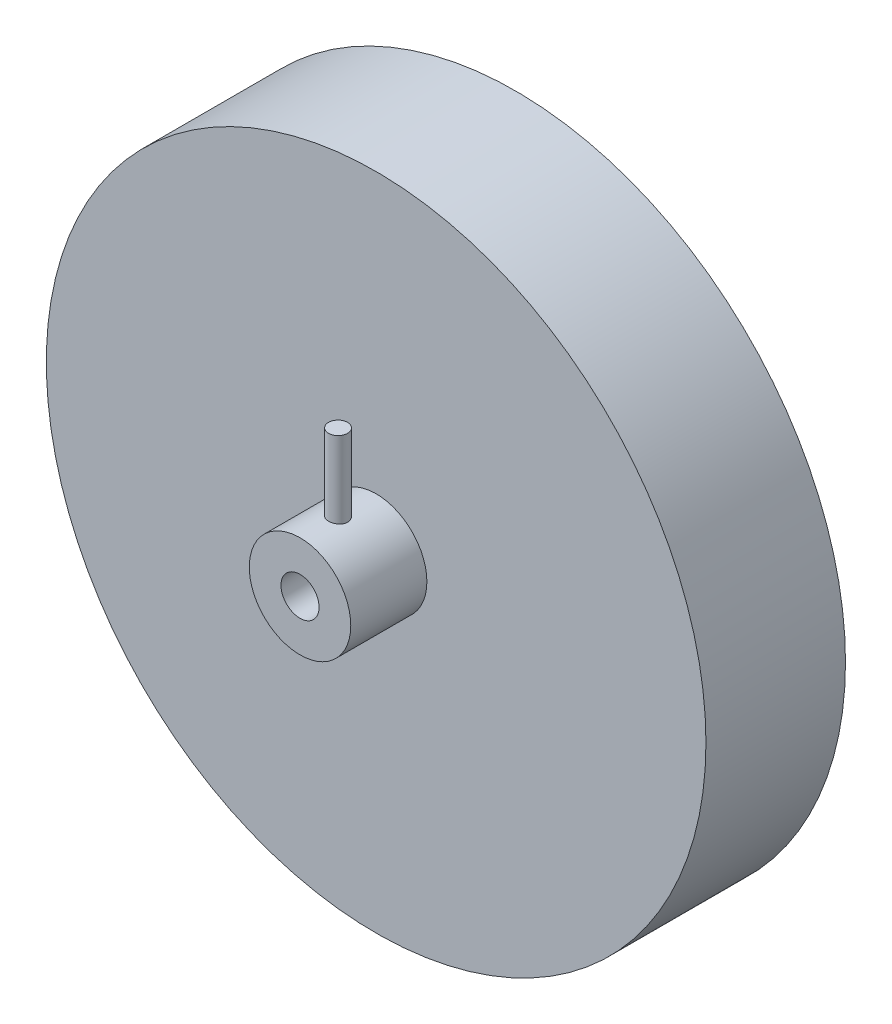
from build123d import *

# Parameters (mm, degrees)
SKETCH1_R           = 52
BOSS_EXTRUDE1_DEPTH = 11
SKETCH2_R           = 8
BOSS_EXTRUDE2_DEPTH = 12
SKETCH3_R           = 1.5
BOSS_EXTRUDE3_DEPTH = 20
SKETCH4_R           = 3
CUT_EXTRUDE3_DEPTH  = 12


with BuildPart() as part:
    # Sketch1 → Boss-Extrude1 (new, symmetric)
    with BuildSketch(Plane.XY):
        Circle(SKETCH1_R)
    extrude(amount=BOSS_EXTRUDE1_DEPTH, both=True)

    # Sketch2 → Boss-Extrude2 (add)
    with BuildSketch(Plane.XY.offset(11)):
        Circle(SKETCH2_R)
    extrude(amount=BOSS_EXTRUDE2_DEPTH)

    # Sketch3 → Boss-Extrude3 (add)
    with BuildSketch(Plane(origin=(0, 0, 0), x_dir=(1, 0, 0), z_dir=(0, 1, 0))):
        with Locations((0, -17)):
            Circle(SKETCH3_R)
    extrude(amount=BOSS_EXTRUDE3_DEPTH)

    # Sketch4 → Cut-Extrude3 (cut)
    with BuildSketch(Plane(origin=(0, 0, 23), x_dir=(-1, 0, 0), z_dir=(0, 0, -1))):
        Circle(SKETCH4_R)
    extrude(amount=CUT_EXTRUDE3_DEPTH, mode=Mode.SUBTRACT)


solid = part.part
